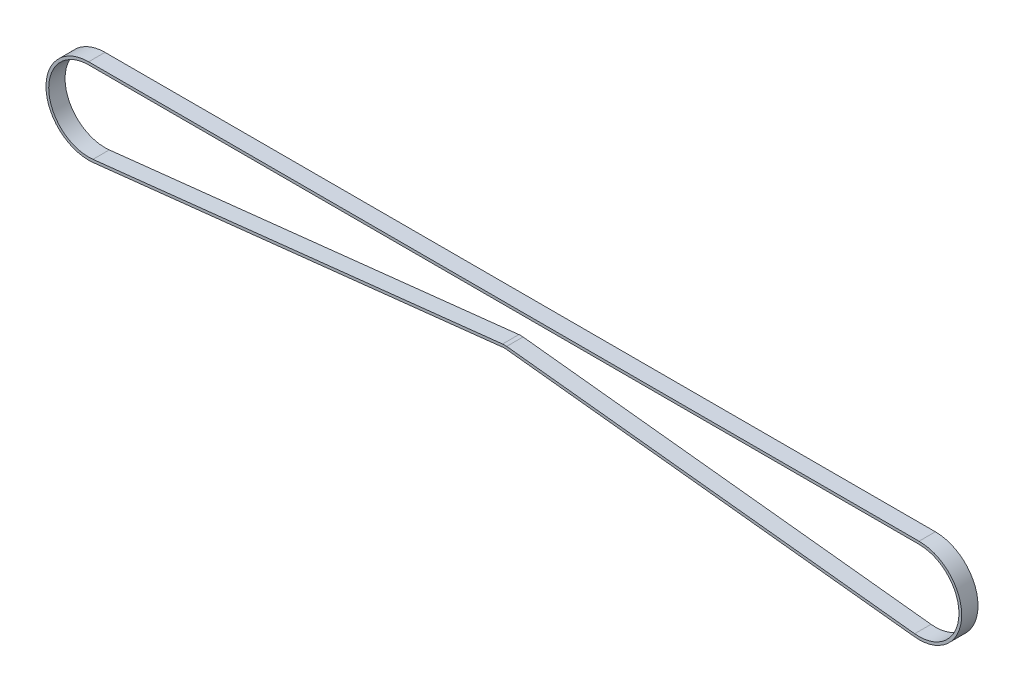
from build123d import *

# Parameters (mm, degrees)
SALIENTE_EXTRUIR1_DEPTH = 6


with BuildPart() as part:
    # Croquis1 → Saliente-Extruir1 (new body)
    with BuildSketch(Plane.XY):
        with BuildLine():
            Line((0, 15.66), (305, 15.66))
            ThreePointArc((305, 15.66), (320.636527956, -0.857084298), (303.288400691, -15.566182185))
            Line((303.288400691, -15.566182185), (153.445000909, 0.91003893))
            ThreePointArc((153.445000909, 0.91003893), (152.790469076, 0.945984322), (152.135922283, 0.910312384))
            Line((152.135922283, 0.910312384), (1.705095905, -15.5668959))
            ThreePointArc((1.705095905, -15.5668959), (-15.636706651, -0.853817958), (0, 15.66))
        make_face()
        with BuildLine():
            Line((0, 14.66), (305, 14.66))
            ThreePointArc((305, 14.66), (319.638026809, -0.8023535), (303.39769822, -14.572173105))
            Line((303.39769822, -14.572173105), (153.554298438, 1.904048009))
            ThreePointArc((153.554298438, 1.904048009), (152.790677967, 1.9459843), (152.027040041, 1.904367039))
            Line((152.027040041, 1.904367039), (1.596213663, -14.572841245))
            ThreePointArc((1.596213663, -14.572841245), (-14.638194094, -0.799295738), (0, 14.66))
        make_face(mode=Mode.SUBTRACT)
    extrude(amount=SALIENTE_EXTRUIR1_DEPTH)


solid = part.part
